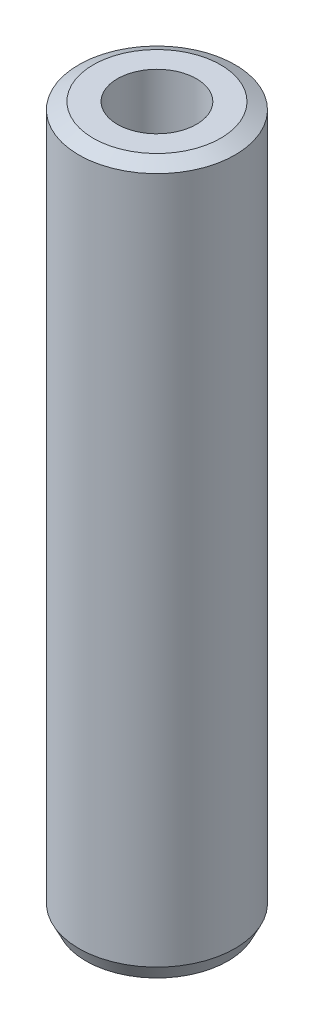
from build123d import *
from OCP.BRepFilletAPI import BRepFilletAPI_MakeChamfer

# Parameters (mm, degrees)
SKETCH1_R           = 47.5
BOSS_EXTRUDE1_DEPTH = 430.662476989
SKETCH2_R           = 24.024256552
CUT_EXTRUDE1_DEPTH  = 436.87001398
CHAMFER1_SIZE       = 4.368561066
CHAMFER1_SIZE2      = 8.807799963


with BuildPart() as part:
    # Sketch1 → Boss-Extrude1 (new body)
    with BuildSketch(Plane(origin=(0, 0, 0), x_dir=(1, 0, 0), z_dir=(0, 1, 0))):
        Circle(SKETCH1_R)
    extrude(amount=BOSS_EXTRUDE1_DEPTH)

    # Sketch2 → Cut-Extrude1 (cut, through all)
    with BuildSketch(Plane(origin=(0, 0, 0), x_dir=(1, 0, 0), z_dir=(0, 1, 0))):
        Circle(SKETCH2_R)
    extrude(amount=CUT_EXTRUDE1_DEPTH, mode=Mode.SUBTRACT)

    # Chamfer1: one chamfer whose edges measure the first distance from different faces: ONE call of the kernel's chamfer builder (chamfer() names one face for all edges)
    chamfer1_edges_1 = [part.edges().sort_by_distance(p)[0] for p in [
        (-47.5, 430.662476989, 0),
    ]]
    chamfer1_side_1 = [part.faces().sort_by_distance(p)[0] for p in [
        (-47.5, 215.331238495, 0),
    ]]
    chamfer1_edges_2 = [part.edges().sort_by_distance(p)[0] for p in [
        (-47.5, 0, 0),
    ]]
    chamfer1_side_2 = [part.faces().sort_by_distance(p)[0] for p in [
        (-46.156497116, 0, 0),
    ]]
    chamfer1 = BRepFilletAPI_MakeChamfer(part.part.solid().wrapped)
    for e in chamfer1_edges_1:
        chamfer1.Add(CHAMFER1_SIZE, CHAMFER1_SIZE2, e.wrapped, chamfer1_side_1[0].wrapped)  # the first distance lies on this face
    for e in chamfer1_edges_2:
        chamfer1.Add(CHAMFER1_SIZE, CHAMFER1_SIZE2, e.wrapped, chamfer1_side_2[0].wrapped)  # the first distance lies on this face
    add(Compound.cast(chamfer1.Shape()), mode=Mode.REPLACE)


solid = part.part
